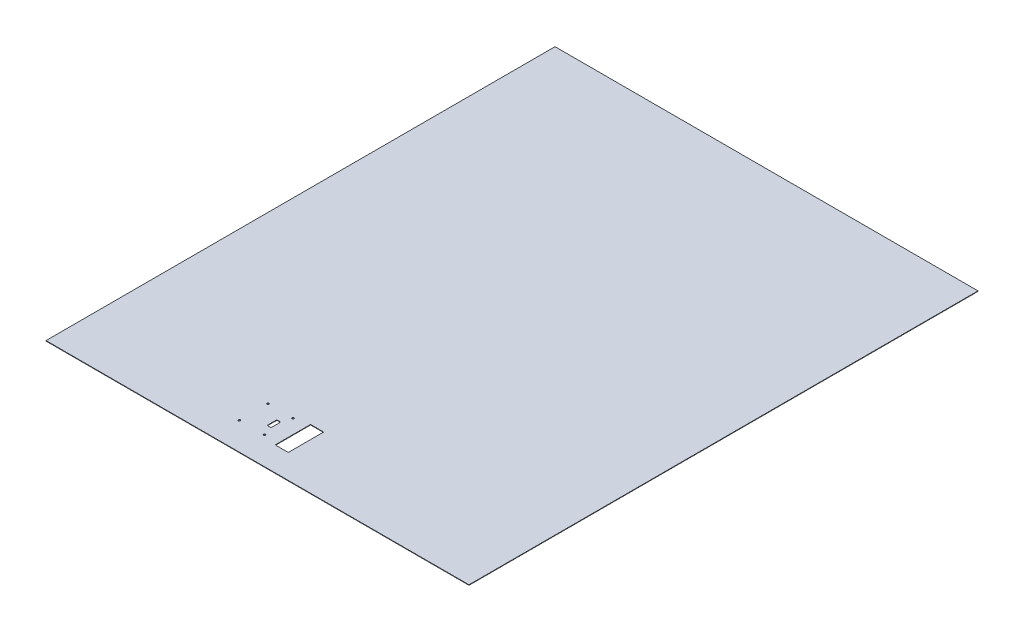
from build123d import *

# Parameters (mm, degrees)
SKETCH1_W           = 872.5
SKETCH1_H           = 1050
BOSS_EXTRUDE1_DEPTH = 1
SKETCH2_W           = 27
SKETCH2_H           = 73
CUT_EXTRUDE1_DEPTH  = 1
SKETCH3_R           = 2
CUT_EXTRUDE2_DEPTH  = 960.938081783
SKETCH4_W           = 8
SKETCH4_H           = 20
CUT_EXTRUDE3_DEPTH  = 1
FILLET1_R           = 2


with BuildPart() as part:
    # Sketch1 → Boss-Extrude1 (new body)
    with BuildSketch(Plane(origin=(0, 0, 0), x_dir=(1, 0, 0), z_dir=(0, 1, 0))):
        with Locations((176.356476286, 214.049001129)):
            Rectangle(SKETCH1_W, SKETCH1_H)
    extrude(amount=BOSS_EXTRUDE1_DEPTH)

    # Sketch2 → Cut-Extrude1 (cut)
    with BuildSketch(Plane(origin=(0, 1, 0), x_dir=(1, 0, 0), z_dir=(0, 1, 0))):
        with Locations((176.356476286, -224.450998871)):
            Rectangle(SKETCH2_W, SKETCH2_H)
    extrude(amount=-CUT_EXTRUDE1_DEPTH, mode=Mode.SUBTRACT)

    # Sketch3 → Cut-Extrude2 (cut, through all)
    with BuildSketch(Plane(origin=(0, 1, 0), x_dir=(1, 0, 0), z_dir=(0, 1, 0))):
        with Locations((133.656476286, -194.950998871)):
            Circle(SKETCH3_R)
        with Locations((133.656476286, -253.950998871)):
            Circle(SKETCH3_R)
        with Locations((81.976476286, -194.950998871)):
            Circle(SKETCH3_R)
        with Locations((81.976476286, -253.950998871)):
            Circle(SKETCH3_R)
    extrude(amount=-CUT_EXTRUDE2_DEPTH, mode=Mode.SUBTRACT)

    # Sketch4 → Cut-Extrude3 (cut)
    with BuildSketch(Plane(origin=(0, 1, 0), x_dir=(1, 0, 0), z_dir=(0, 1, 0))):
        with Locations((123.756476286, -224.450998871)):
            Rectangle(SKETCH4_W, SKETCH4_H)
    extrude(amount=-CUT_EXTRUDE3_DEPTH, mode=Mode.SUBTRACT)

    # Fillet1
    fillet1_edges = [part.edges().sort_by_distance(p)[0] for p in [
        (119.756476286, 0.5, 214.450998871),
        (119.756476286, 0.5, 234.450998871),
        (127.756476286, 0.5, 234.450998871),
        (127.756476286, 0.5, 214.450998871),
    ]]
    fillet(fillet1_edges, radius=FILLET1_R)


solid = part.part
